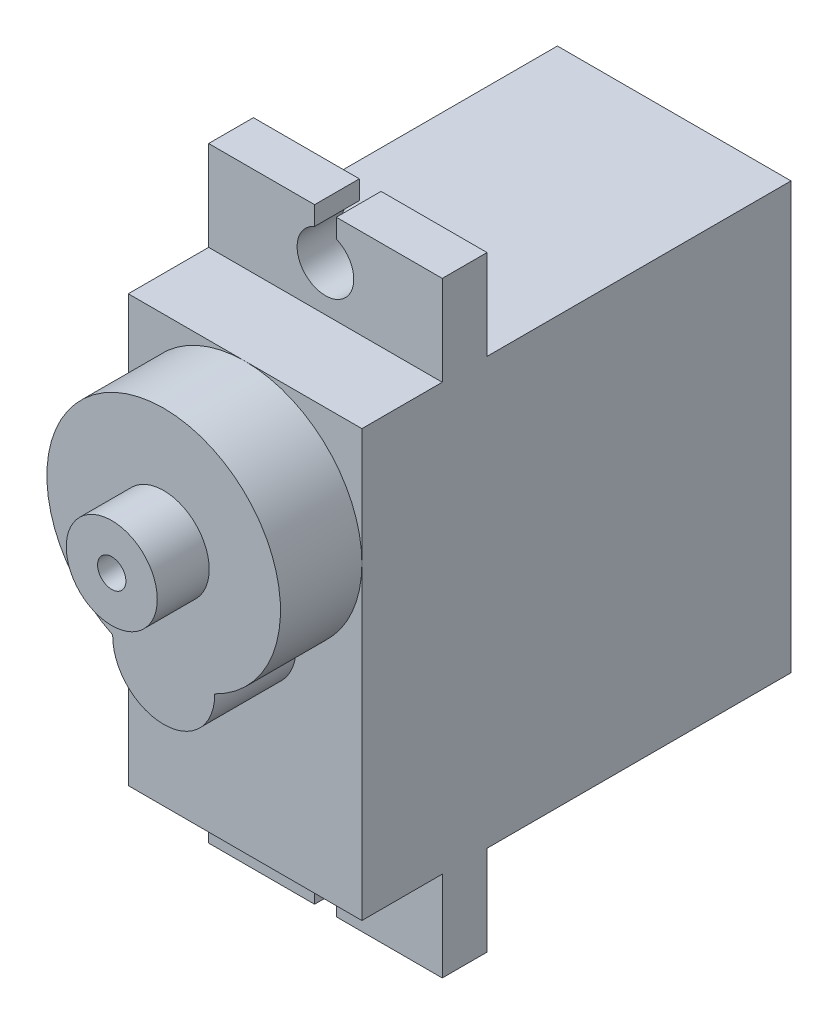
from build123d import *

# Parameters (mm, degrees)
SKETCH1_W           = 12.3698
SKETCH1_H           = 22.5552
BOSS_EXTRUDE1_DEPTH = 11.36015
BOSS_EXTRUDE2_DEPTH = 2.37
BOSS_EXTRUDE3_DEPTH = 4.31
SKETCH4_R           = 2.41
SKETCH4_R_2         = 0.75
BOSS_EXTRUDE4_DEPTH = 2.75


with BuildPart() as part:
    # Sketch1 → Boss-Extrude1 (new, symmetric)
    with BuildSketch(Plane.XY):
        Rectangle(SKETCH1_W, SKETCH1_H)
    extrude(amount=BOSS_EXTRUDE1_DEPTH, both=True)

    # Sketch2 → Boss-Extrude2 (add)
    with BuildSketch(Plane.XY.offset(7.10565)):
        with BuildLine():
            Line((-0.575, 16.0401), (-6.1849, 16.0401))
            Line((-6.1849, 16.0401), (-6.1849, 11.2776))
            Line((-6.1849, 11.2776), (6.1849, 11.2776))
            Line((6.1849, 11.2776), (6.1849, 16.0401))
            Line((6.1849, 16.0401), (0.575, 16.0401))
            Line((0.575, 16.0401), (0.575, 15.0401))
            ThreePointArc((0.575, 15.0401), (0, 12.1546849), (-0.575, 15.0401))
            Line((-0.575, 15.0401), (-0.575, 16.0401))
        make_face()
    boss_extrude2 = extrude(amount=-BOSS_EXTRUDE2_DEPTH)

    # Mirror1: Boss-Extrude2 across plane
    add(boss_extrude2.mirror(Plane.ZX))

    # Sketch3 → Boss-Extrude3 (add)
    with BuildSketch(Plane.XY.offset(11.36015)):
        with BuildLine():
            Line((2.7, -0.5224), (2.7, -0.471739595))
            ThreePointArc((2.7, -0.471739595), (0, 11.2776), (-2.7, -0.471739595))
            Line((-2.7, -0.471739595), (-2.7, -0.5224))
            ThreePointArc((-2.7, -0.5224), (0, -3.2224), (2.7, -0.5224))
        make_face()
    extrude(amount=BOSS_EXTRUDE3_DEPTH)

    # Sketch4 → Boss-Extrude4 (add)
    with BuildSketch(Plane.XY.offset(15.67015)):
        with Locations((0, 5.0927)):
            Circle(SKETCH4_R)
        with Locations((0, 5.0927)):
            Circle(SKETCH4_R_2, mode=Mode.SUBTRACT)
    extrude(amount=BOSS_EXTRUDE4_DEPTH)


solid = part.part
